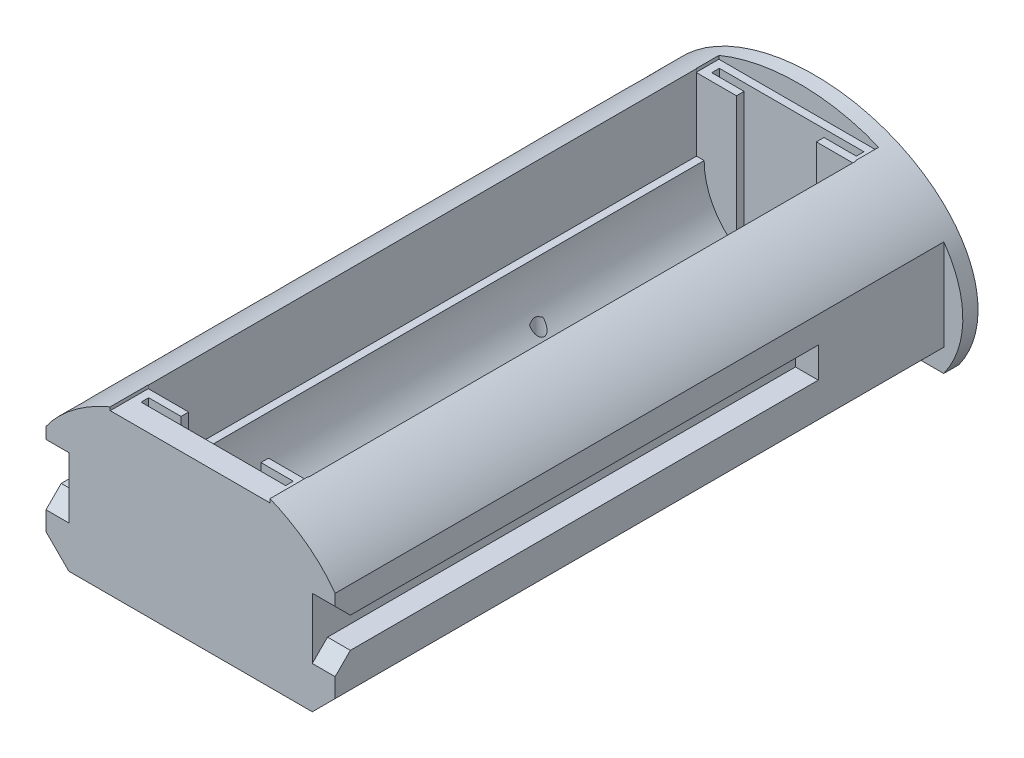
from build123d import *

# Parameters (mm, degrees)
SKIZZE1_RX                           = 21.5
SKIZZE1_RY                           = 16
AUFSATZ_LINEAR_AUSTRAGEN1_DEPTH      = 82
SKIZZE2_W                            = 21
SKIZZE2_H                            = 72
SCHNITT_LINEAR_AUSTRAGEN1_DEPTH      = 12
SCHNITT_LINEAR_START                 = -5
SKIZZE3_R                            = 9.5
SCHNITT_LINEAR_AUSTRAGEN2_DEPTH      = 72
SKIZZE4_W                            = 21
SKIZZE4_H                            = 3
SCHNITT_LINEAR_AUSTRAGEN3_DEPTH      = 2.5
SKIZZE5_W                            = 10.5
SKIZZE5_H                            = 1
SCHNITT_LINEAR_AUSTRAGEN4_DEPTH      = 18
SKIZZE6_W                            = 5.5
SKIZZE6_H                            = 1
SCHNITT_LINEAR_AUSTRAGEN5_DEPTH      = 90.758008147
SKIZZE7_W                            = 19
SKIZZE7_H                            = 1
SCHNITT_LINEAR_AUSTRAGEN6_DEPTH      = 19
SCHNITT_LINEAR_AUSTRAGEN7_DEPTH      = 80
SCHNITT_LINEAR_AUSTRAGEN10_DEPTH     = 85.369722196
FASE4_START                          = -20
FASE4_OUTLINE_W                      = 4.242640687
FASE4_OUTLINE_H                      = 80
FASE4_DEPTH                          = 3.382990642
FASE5_START                          = 16.617009358
FASE5_OUTLINE_W                      = 4.242640687
FASE5_OUTLINE_H                      = 80
FASE5_DEPTH                          = 3.382990642
SKIZZE12_W                           = 3
SKIZZE12_H                           = 4
SCHNITT_LINEAR_AUSTRAGEN11_DEPTH     = 63.5
FASE6_SIZE                           = 2
F_2_8_2_8_DURCHMESSER_BOHRUNG1_D     = 2.8
F_2_8_2_8_DURCHMESSER_BOHRUNG1_DEPTH = 16
F_2_8_2_8_DURCHMESSER_BOHRUNG1_TIP   = 0.841204867
F_1_8_1_8_DURCHMESSER_BOHRUNG1_D     = 1.8
F_1_8_1_8_DURCHMESSER_BOHRUNG1_DEPTH = 6
F_1_8_1_8_DURCHMESSER_BOHRUNG1_TIP   = 0.540774557
SKIZZE18_W                           = 44.148938554
SKIZZE18_H                           = 10.779995729
SCHNITT_LINEAR_AUSTRAGEN12_DEPTH     = 85.369722196
F_1_8_1_8_DURCHMESSER_BOHRUNG2_D     = 1.8
F_1_8_1_8_DURCHMESSER_BOHRUNG2_DEPTH = 6
F_1_8_1_8_DURCHMESSER_BOHRUNG2_TIP   = 0.540774557
SCHNITT_LINEAR_START_2               = 1
SCHNITT_LINEAR_AUSTRAGEN13_DEPTH     = 3
SKIZZE23_W                           = 10
SKIZZE23_H                           = 1.5
SCHNITT_LINEAR_AUSTRAGEN14_DEPTH     = 3


with BuildPart() as part:
    # Skizze1 → Aufsatz-Linear austragen1 (new body)
    with BuildSketch(Plane.XY):
        with Locations((0, 0)):
            Ellipse(SKIZZE1_RX, SKIZZE1_RY)
    extrude(amount=AUFSATZ_LINEAR_AUSTRAGEN1_DEPTH)

    # Skizze2 → Schnitt-Linear austragen1 (cut)
    with BuildSketch(Plane(origin=(0, 16, 0), x_dir=(1, 0, 0), z_dir=(0, 1, 0))):
        with Locations((0, -41)):
            Rectangle(SKIZZE2_W, SKIZZE2_H)
    extrude(amount=-SCHNITT_LINEAR_AUSTRAGEN1_DEPTH, mode=Mode.SUBTRACT)

    # Skizze3 → Schnitt-Linear austragen2 (cut)
    with BuildSketch(Plane(origin=(0, 0, 0), x_dir=(-1, 0, 0), z_dir=(0, 0, -1)).offset(SCHNITT_LINEAR_START)):
        with Locations((0, 4)):
            Circle(SKIZZE3_R)
    extrude(amount=-SCHNITT_LINEAR_AUSTRAGEN2_DEPTH, mode=Mode.SUBTRACT)

    # Skizze4 → Schnitt-Linear austragen3 (cut)
    with BuildSketch(Plane(origin=(0, 16, 0), x_dir=(1, 0, 0), z_dir=(0, 1, 0))):
        with Locations((-0.057260454, -3.5)):
            Rectangle(SKIZZE4_W, SKIZZE4_H)
    schnitt_linear_austragen3 = extrude(amount=-SCHNITT_LINEAR_AUSTRAGEN3_DEPTH, mode=Mode.SUBTRACT)

    # Skizze5 → Schnitt-Linear austragen4 (cut)
    with BuildSketch(Plane(origin=(0, 13.5, 0), x_dir=(1, 0, 0), z_dir=(0, 1, 0))):
        with Locations((0, -4.5)):
            Rectangle(SKIZZE5_W, SKIZZE5_H)
    schnitt_linear_austragen4 = extrude(amount=-SCHNITT_LINEAR_AUSTRAGEN4_DEPTH, mode=Mode.SUBTRACT)

    # Skizze6 → Schnitt-Linear austragen5 (cut, through all)
    with BuildSketch(Plane(origin=(0, 13.5, 0), x_dir=(1, 0, 0), z_dir=(0, 1, 0))):
        with Locations((0, -3.5)):
            Rectangle(SKIZZE6_W, SKIZZE6_H)
    schnitt_linear_austragen5 = extrude(amount=-SCHNITT_LINEAR_AUSTRAGEN5_DEPTH, mode=Mode.SUBTRACT)

    # Skizze7 → Schnitt-Linear austragen6 (cut)
    with BuildSketch(Plane(origin=(0, 13.5, 0), x_dir=(1, 0, 0), z_dir=(0, 1, 0))):
        with Locations((0, -3.5)):
            Rectangle(SKIZZE7_W, SKIZZE7_H)
    schnitt_linear_austragen6 = extrude(amount=-SCHNITT_LINEAR_AUSTRAGEN6_DEPTH, mode=Mode.SUBTRACT)

    # Spiegeln3: Schnitt-Linear austragen3, Schnitt-Linear austragen4, Schnitt-Linear austragen5, Schnitt-Linear austragen6 across plane
    add(schnitt_linear_austragen3.mirror(Plane(origin=(0, 0, 41), x_dir=(1, 0, 0), z_dir=(0, 0, -1))), mode=Mode.SUBTRACT)
    add(schnitt_linear_austragen4.mirror(Plane(origin=(0, 0, 41), x_dir=(1, 0, 0), z_dir=(0, 0, -1))), mode=Mode.SUBTRACT)
    add(schnitt_linear_austragen5.mirror(Plane(origin=(0, 0, 41), x_dir=(1, 0, 0), z_dir=(0, 0, -1))), mode=Mode.SUBTRACT)
    add(schnitt_linear_austragen6.mirror(Plane(origin=(0, 0, 41), x_dir=(1, 0, 0), z_dir=(0, 0, -1))), mode=Mode.SUBTRACT)

    # Skizze8 → Schnitt-Linear austragen7 (cut)
    with BuildSketch(Plane.XY.offset(82)):
        Polygon((-19, 10.132223752), (-19, -7.5), (19, -7.5), (19, 10.132223752), (23.595995944, 10.132223752), (23.595995944, -17.63513496), (-23.77015657, -17.63513496), (-23.77015657, 10.132223752), align=None)
    extrude(amount=-SCHNITT_LINEAR_AUSTRAGEN7_DEPTH, mode=Mode.SUBTRACT)

    # Skizze11 → Schnitt-Linear austragen10 (cut, through all)
    with BuildSketch(Plane(origin=(0, 0, 80), x_dir=(-1, 0, 0), z_dir=(0, 0, -1))):
        Polygon((10.557260454, 16.409023514), (10.557260454, 13.5), (-10.442739546, 13.5), (-10.442739546, 16.092896626), align=None)
    extrude(amount=-SCHNITT_LINEAR_AUSTRAGEN10_DEPTH, mode=Mode.SUBTRACT)

    # Fase4: read off the stored shape, not the designer's step
    # Fase4 outline → Fase4 (cut)
    with BuildSketch(Plane(origin=(0, 0, 0), x_dir=(0.7071067811865474, -0.7071067811865477, 0), z_dir=(0.7071067811865476, 0.7071067811865476, 0)).offset(FASE4_START)):
        with Locations((-8.131727983, -42)):
            Rectangle(FASE4_OUTLINE_W, FASE4_OUTLINE_H)
    extrude(amount=FASE4_DEPTH, mode=Mode.SUBTRACT)

    # Fase5: read off the stored shape, not the designer's step
    # Fase5 outline → Fase5 (cut)
    with BuildSketch(Plane(origin=(0, 0, 0), x_dir=(0.7071067811865471, 0.707106781186548, 0), z_dir=(0.707106781186548, -0.707106781186547, 0)).offset(FASE5_START)):
        with Locations((8.131727983, 42)):
            Rectangle(FASE5_OUTLINE_W, FASE5_OUTLINE_H)
    extrude(amount=FASE5_DEPTH, mode=Mode.SUBTRACT)

    # Skizze12 → Schnitt-Linear austragen11 (cut)
    with BuildSketch(Plane.XY.offset(82)):
        with Locations((-17.5, 2)):
            Rectangle(SKIZZE12_W, SKIZZE12_H)
        with Locations((17.5, 2)):
            Rectangle(SKIZZE12_W, SKIZZE12_H)
    extrude(amount=-SCHNITT_LINEAR_AUSTRAGEN11_DEPTH, mode=Mode.SUBTRACT)

    # Fase6
    fase6_edges = [part.edges().sort_by_distance(p)[0] for p in [
        (-17.5, 0, 82),
        (-17.5, 4, 82),
        (17.5, 4, 82),
        (17.5, 0, 82),
    ]]
    chamfer(fase6_edges, length=FASE6_SIZE)

    # Ø2.8 (2.8) Durchmesser Bohrung1
    with Locations(Plane(origin=(-15, 2, 0), x_dir=(-1, 0, 0), z_dir=(0, 0, -1))):
        with Locations((0, 0), (-30, 0)):
            Hole(F_2_8_2_8_DURCHMESSER_BOHRUNG1_D / 2, depth=F_2_8_2_8_DURCHMESSER_BOHRUNG1_DEPTH)
            with Locations((0, 0, -(F_2_8_2_8_DURCHMESSER_BOHRUNG1_DEPTH + F_2_8_2_8_DURCHMESSER_BOHRUNG1_TIP / 2))):  # 118° drill point
                Cone(0, F_2_8_2_8_DURCHMESSER_BOHRUNG1_D / 2, F_2_8_2_8_DURCHMESSER_BOHRUNG1_TIP, mode=Mode.SUBTRACT)

    # Ø1.8 (1.8) Durchmesser Bohrung1
    with Locations(Plane(origin=(-9.725, -7.5, 64.728363243), x_dir=(0, 0, -1), z_dir=(0, -1, 0))):
        with Locations((0, 0), (0, 19.45), (18.228363243, 19.45), (18.228363243, 0), (28.5, 0), (28.5, 19.45), (46.728363243, 0), (46.728363243, 19.45)):
            Hole(F_1_8_1_8_DURCHMESSER_BOHRUNG1_D / 2, depth=F_1_8_1_8_DURCHMESSER_BOHRUNG1_DEPTH)
            with Locations((0, 0, -(F_1_8_1_8_DURCHMESSER_BOHRUNG1_DEPTH + F_1_8_1_8_DURCHMESSER_BOHRUNG1_TIP / 2))):  # 118° drill point
                Cone(0, F_1_8_1_8_DURCHMESSER_BOHRUNG1_D / 2, F_1_8_1_8_DURCHMESSER_BOHRUNG1_TIP, mode=Mode.SUBTRACT)

    # Skizze18 → Schnitt-Linear austragen12 (cut, through all)
    with BuildSketch(Plane.XY.offset(2)):
        with Locations((-0.27904822, -12.889997864)):
            Rectangle(SKIZZE18_W, SKIZZE18_H)
    extrude(amount=-SCHNITT_LINEAR_AUSTRAGEN12_DEPTH, mode=Mode.SUBTRACT)

    # Ø1.8 (1.8) Durchmesser Bohrung2
    with Locations(Plane(origin=(-13, -7.5, 74), x_dir=(0, 0, -1), z_dir=(0, -1, 0))):
        with Locations((0, 0), (0, 26), (66, 26), (66, 0), (62, 4.1), (62, 21.9), (16.3, 21.9), (16.3, 4.1), (4.480553326, 5.4), (4.480553326, 20.6), (45.180553326, 20.6), (45.180553326, 5.4), (6, 0), (6, 26), (41, 26), (41, 0)):
            Hole(F_1_8_1_8_DURCHMESSER_BOHRUNG2_D / 2, depth=F_1_8_1_8_DURCHMESSER_BOHRUNG2_DEPTH)
            with Locations((0, 0, -(F_1_8_1_8_DURCHMESSER_BOHRUNG2_DEPTH + F_1_8_1_8_DURCHMESSER_BOHRUNG2_TIP / 2))):  # 118° drill point
                Cone(0, F_1_8_1_8_DURCHMESSER_BOHRUNG2_D / 2, F_1_8_1_8_DURCHMESSER_BOHRUNG2_TIP, mode=Mode.SUBTRACT)

    # Skizze21 → Schnitt-Linear austragen13 (cut)
    with BuildSketch(Plane(origin=(0, -4.5, 0), x_dir=(1, 0, 0), z_dir=(0, 1, 0)).offset(SCHNITT_LINEAR_START_2)):
        Polygon((-5, -69.25), (-0.75, -69.25), (-0.75, -65), (0.75, -65), (0.75, -69.25), (5, -69.25), (5, -70.75), (0.75, -70.75), (0.75, -75), (-0.75, -75), (-0.75, -70.75), (-5, -70.75), align=None)
    extrude(amount=-SCHNITT_LINEAR_AUSTRAGEN13_DEPTH, mode=Mode.SUBTRACT)

    # Skizze23 → Schnitt-Linear austragen14 (cut)
    with BuildSketch(Plane(origin=(0, -4.5, 0), x_dir=(1, 0, 0), z_dir=(0, 1, 0)).offset(SCHNITT_LINEAR_START_2)):
        with Locations((0, -10.099084926)):
            Rectangle(SKIZZE23_W, SKIZZE23_H)
    extrude(amount=-SCHNITT_LINEAR_AUSTRAGEN14_DEPTH, mode=Mode.SUBTRACT)


solid = part.part
